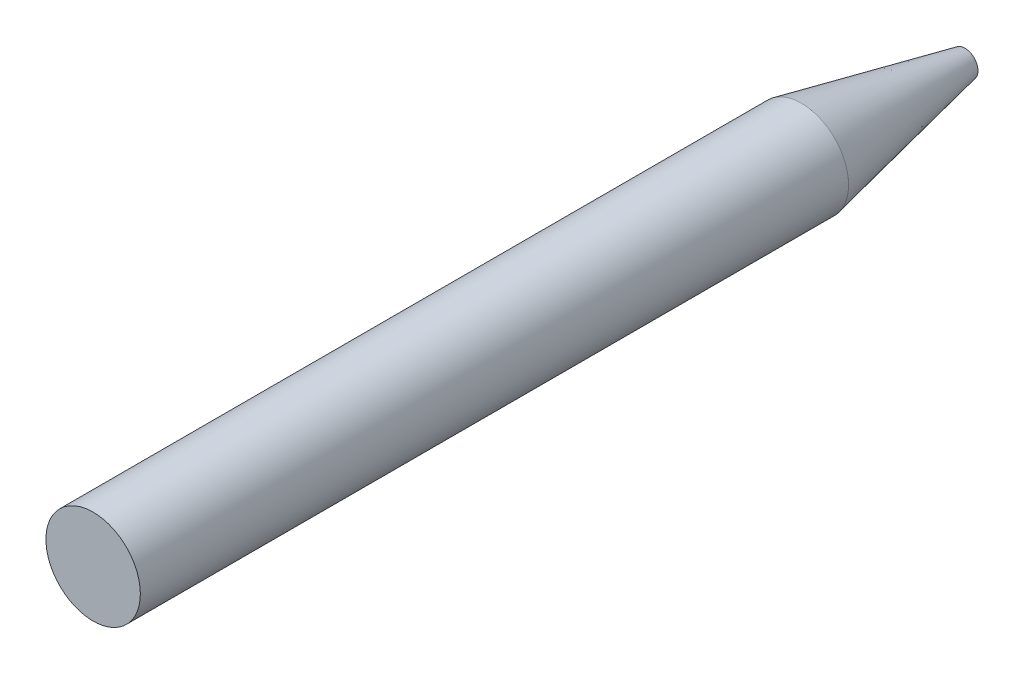
from build123d import *

# Parameters (mm, degrees)
SKETCH1_R           = 25.4
BOSS_EXTRUDE3_DEPTH = 381


with BuildPart() as part:
    # Sketch1 → Boss-Extrude3 (new body)
    with BuildSketch(Plane.XY):
        Circle(SKETCH1_R)
    extrude(amount=BOSS_EXTRUDE3_DEPTH)

    # Sketch2 → Revolve1 (revolve)
    with BuildSketch(Plane(origin=(0, 0, 0), x_dir=(1, 0, 0), z_dir=(0, 1, 0))):
        Polygon((-25.4, 0), (0, 0), (0, 88.011174877), (-7.010963676, 88.011174877), align=None)
    revolve(axis=Axis((0, 0, 0), (0, 0, -1)))


solid = part.part
